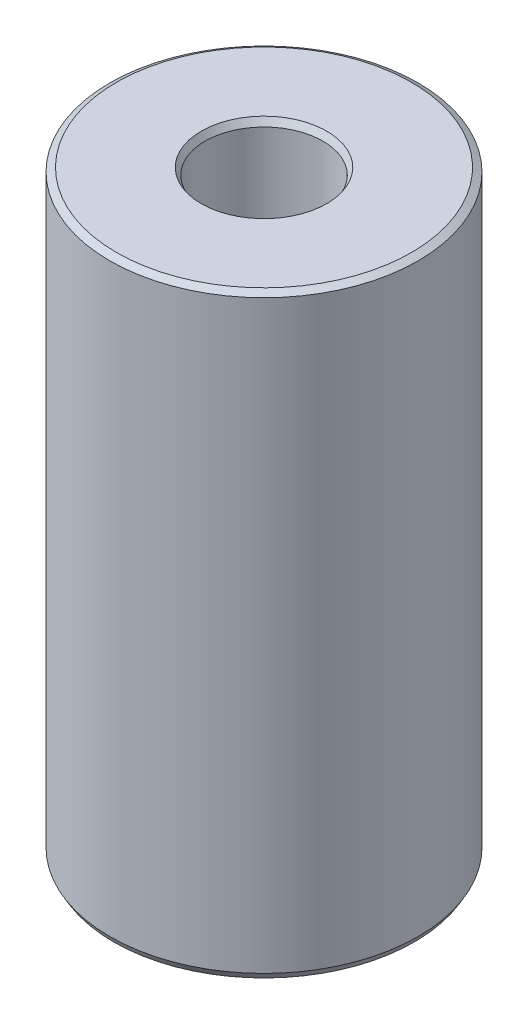
from build123d import *
from OCP.BRepFilletAPI import BRepFilletAPI_MakeChamfer

# Parameters (mm, degrees)
SKETCH1_R           = 10
BOSS_EXTRUDE1_DEPTH = 38.647670487
SKETCH2_R           = 3.823743498
CUT_EXTRUDE1_DEPTH  = 42.153887229
CHAMFER1_SIZE       = 0.249998531
CHAMFER1_SIZE2      = 0.433010157


with BuildPart() as part:
    # Sketch1 → Boss-Extrude1 (new body)
    with BuildSketch(Plane(origin=(0, 0, 0), x_dir=(1, 0, 0), z_dir=(0, 1, 0))):
        Circle(SKETCH1_R)
    extrude(amount=BOSS_EXTRUDE1_DEPTH)

    # Sketch2 → Cut-Extrude1 (cut, through all)
    with BuildSketch(Plane(origin=(0, 0, 0), x_dir=(1, 0, 0), z_dir=(0, 1, 0))):
        Circle(SKETCH2_R)
    extrude(amount=CUT_EXTRUDE1_DEPTH, mode=Mode.SUBTRACT)

    # Chamfer1: one chamfer whose edges measure the first distance from different faces: ONE call of the kernel's chamfer builder (chamfer() names one face for all edges)
    chamfer1_edges_1 = [part.edges().sort_by_distance(p)[0] for p in [
        (-3.823743498, 38.647670487, 0),
    ]]
    chamfer1_side_1 = [part.faces().sort_by_distance(p)[0] for p in [
        (-9.717157288, 38.647670487, 0),
    ]]
    chamfer1_edges_2 = [part.edges().sort_by_distance(p)[0] for p in [
        (-3.823743498, 0, 0),
    ]]
    chamfer1_side_2 = [part.faces().sort_by_distance(p)[0] for p in [
        (-3.823743498, 19.323835243, 0),
    ]]
    chamfer1_edges_3 = [part.edges().sort_by_distance(p)[0] for p in [
        (-10, 0, 0),
    ]]
    chamfer1_side_3 = [part.faces().sort_by_distance(p)[0] for p in [
        (-9.717157288, 0, 0),
    ]]
    chamfer1_edges_4 = [part.edges().sort_by_distance(p)[0] for p in [
        (-10, 38.647670487, 0),
    ]]
    chamfer1_side_4 = [part.faces().sort_by_distance(p)[0] for p in [
        (-10, 19.323835243, 0),
    ]]
    chamfer1 = BRepFilletAPI_MakeChamfer(part.part.solid().wrapped)
    for e in chamfer1_edges_1:
        chamfer1.Add(CHAMFER1_SIZE, CHAMFER1_SIZE2, e.wrapped, chamfer1_side_1[0].wrapped)  # the first distance lies on this face
    for e in chamfer1_edges_2:
        chamfer1.Add(CHAMFER1_SIZE, CHAMFER1_SIZE2, e.wrapped, chamfer1_side_2[0].wrapped)  # the first distance lies on this face
    for e in chamfer1_edges_3:
        chamfer1.Add(CHAMFER1_SIZE, CHAMFER1_SIZE2, e.wrapped, chamfer1_side_3[0].wrapped)  # the first distance lies on this face
    for e in chamfer1_edges_4:
        chamfer1.Add(CHAMFER1_SIZE, CHAMFER1_SIZE2, e.wrapped, chamfer1_side_4[0].wrapped)  # the first distance lies on this face
    add(Compound.cast(chamfer1.Shape()), mode=Mode.REPLACE)


solid = part.part
